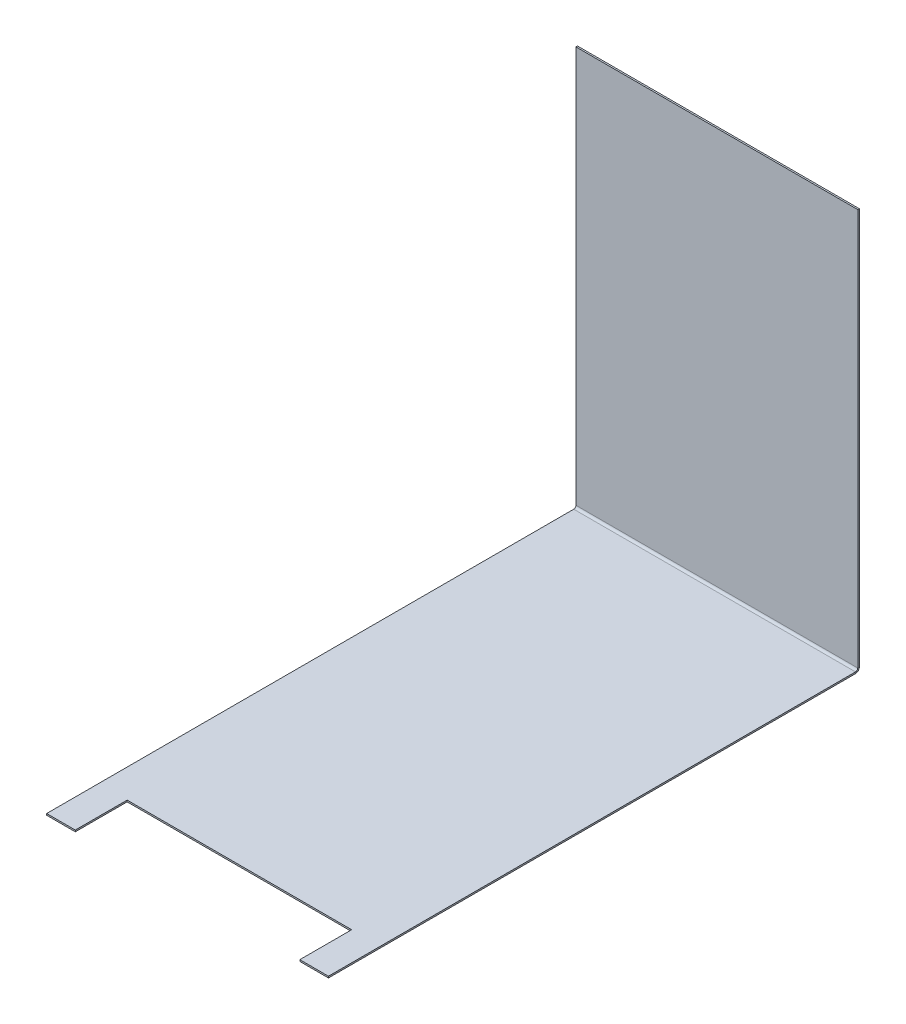
from build123d import *

# Parameters (mm, degrees)
SKETCH1_W          = 125
SKETCH1_H          = 210
BASE_FLANGE1_DEPTH = 0.7
EDGE_FLANGE1_DEPTH = 125
SKETCH9_W          = 12.7
SKETCH9_H          = 23
TAB1_DEPTH         = 0.7
SKETCH12_W         = 12.7
SKETCH12_H         = 23
TAB2_DEPTH         = 0.7


# Sheet-metal steps are written as plain solids
with BuildPart() as part:
    # Sketch1 → Base-Flange1 (new body)
    with BuildSketch(Plane(origin=(0, 0, 0), x_dir=(1, 0, 0), z_dir=(0, 1, 0))):
        Rectangle(SKETCH1_W, SKETCH1_H)
    extrude(amount=-BASE_FLANGE1_DEPTH)

    # Edge-Flange1 section (across the edge) → Edge-Flange1 (add)
    with BuildSketch(Plane(origin=(62.5, 0, -106.8), x_dir=(0, 0, 1), z_dir=(-1, 0, 0))):
        with BuildLine():
            Line((-0.7, 1), (-0.7, 177.1))
            Line((-0.7, 177.1), (0, 177.1))
            Line((0, 177.1), (0, 1))
            ThreePointArc((0, 1), (0.292893219, 0.292893219), (1, 0))
            Line((1, 0), (1.8, 0))
            Line((1.8, 0), (1.8, -0.7))
            Line((1.8, -0.7), (1, -0.7))
            ThreePointArc((1, -0.7), (-0.202081528, -0.202081528), (-0.7, 1))
        make_face()
    extrude(amount=EDGE_FLANGE1_DEPTH)

    # Sketch9 → Tab1 (add)
    with BuildSketch(Plane(origin=(0, 0, 0), x_dir=(1, 0, 0), z_dir=(0, 1, 0))):
        with Locations((-56.15, -116.5)):
            Rectangle(SKETCH9_W, SKETCH9_H)
    extrude(amount=-TAB1_DEPTH)

    # Sketch12 → Tab2 (add)
    with BuildSketch(Plane(origin=(0, 0, 0), x_dir=(1, 0, 0), z_dir=(0, 1, 0))):
        with Locations((56.15, -116.5)):
            Rectangle(SKETCH12_W, SKETCH12_H)
    extrude(amount=-TAB2_DEPTH)


solid = part.part
